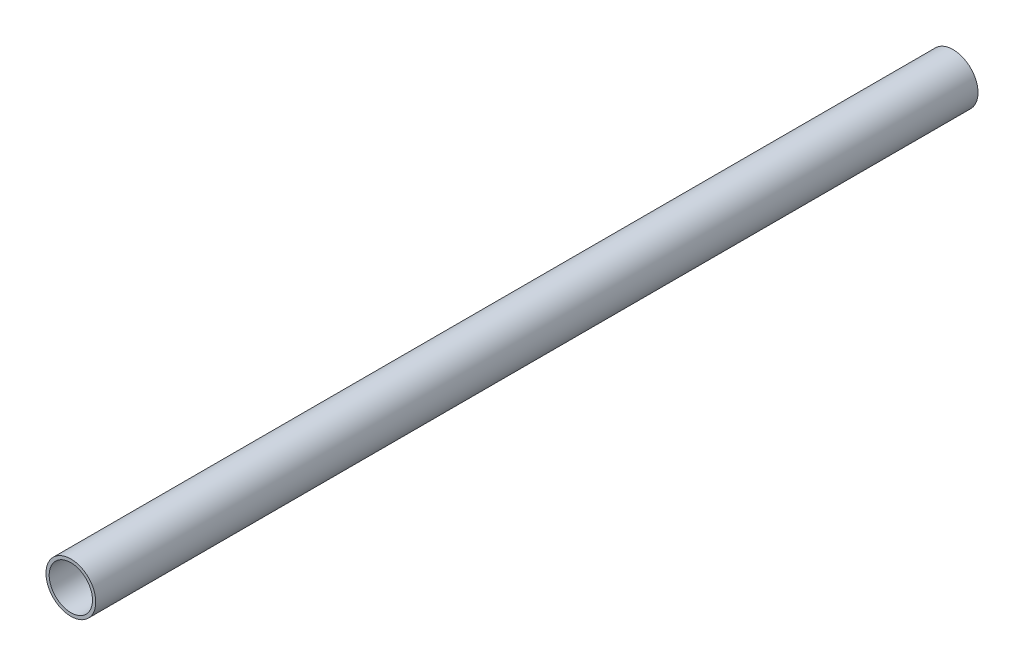
from build123d import *

# Parameters (mm, degrees)
SKETCH1_R           = 12.7
SKETCH1_R_2         = 11.049
BOSS_EXTRUDE1_DEPTH = 450


with BuildPart() as part:
    # Sketch1 → Boss-Extrude1 (new body)
    with BuildSketch(Plane.XY):
        Circle(SKETCH1_R)
        Circle(SKETCH1_R_2, mode=Mode.SUBTRACT)
    extrude(amount=BOSS_EXTRUDE1_DEPTH)


solid = part.part
